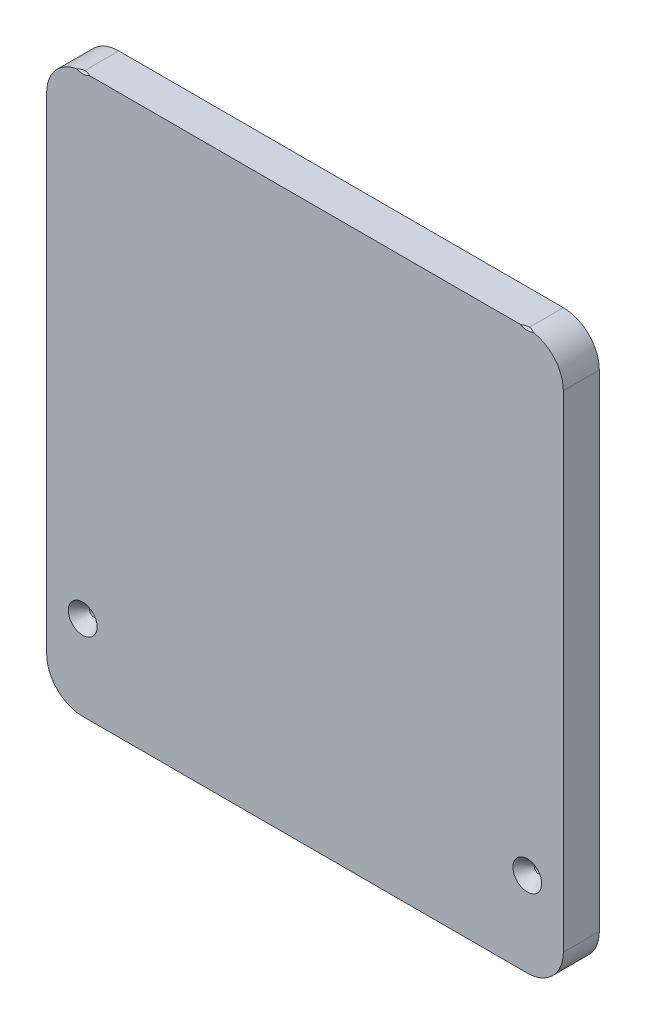
from build123d import *

# Parameters (mm, degrees)
SKETCH1_W           = 182.149999994
SKETCH1_H           = 196.85
BOSS_EXTRUDE1_DEPTH = 12.7
FILLET1_R           = 12.7
HOLE1_D             = 3.175
HOLE1_DEPTH         = 31.75
HOLE1_CSINK_D       = 10.16
HOLE1_CSINK_ANGLE   = 82
HOLE1_TIP           = 0.953866233


with BuildPart() as part:
    # Sketch1 → Boss-Extrude1 (new body)
    with BuildSketch(Plane.XY):
        with Locations((47.975000003, 766.50216301)):
            Rectangle(SKETCH1_W, SKETCH1_H)
    extrude(amount=BOSS_EXTRUDE1_DEPTH)

    # Fillet1
    fillet1_edges = [part.edges().sort_by_distance(p)[0] for p in [
        (139.05, 864.92716301, 6.35),
        (139.05, 668.07716301, 6.35),
        (-43.099999994, 668.07716301, 6.35),
        (-43.099999994, 864.92716301, 6.35),
    ]]
    fillet(fillet1_edges, radius=FILLET1_R)

    # Hole1
    with Locations(Plane(origin=(47.975000003, -440.812032837, 12.7), x_dir=(1, 0, 0), z_dir=(0, 0, 1))):
        with Locations((-78.374999997, 1310.187770337), (-78.374999997, 1138.737770337), (78.374999997, 1138.737770337), (78.374999997, 1310.187770337)):
            CounterSinkHole(HOLE1_D / 2, HOLE1_CSINK_D / 2, depth=HOLE1_DEPTH, counter_sink_angle=HOLE1_CSINK_ANGLE)
            with Locations((0, 0, -(HOLE1_DEPTH + HOLE1_TIP / 2))):  # 118° drill point
                Cone(0, HOLE1_D / 2, HOLE1_TIP, mode=Mode.SUBTRACT)


solid = part.part
